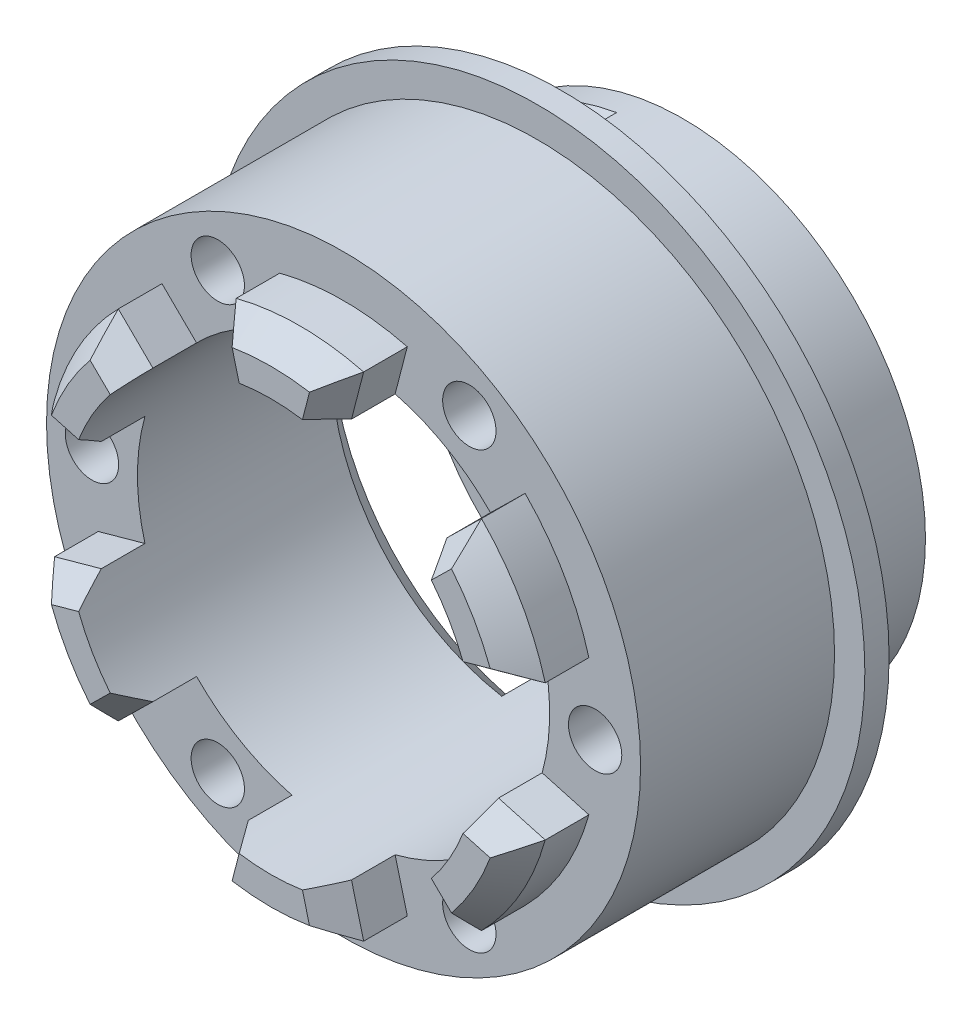
from build123d import *
from OCP.BRepFilletAPI import BRepFilletAPI_MakeChamfer

# Parameters (mm, degrees)
SKETCH_1_R          = 10
EXTRUDE_1_DEPTH     = 2
SKETCH_2_R          = 10
SKETCH_2_R_2        = 8.5
EXTRUDE_2_DEPTH     = 3
SKETCH_4_R          = 13.5
SKETCH_4_R_2        = 8.5
EXTRUDE_3_DEPTH     = 1
SKETCH_5_R          = 12.25
SKETCH_5_R_2        = 8.5
EXTRUDE_4_DEPTH     = 8
SKETCH_6_R          = 1.1
CUT_EXTRUDE_1_DEPTH = 8
SKETCH_7_R          = 3
SKETCH_7_R_2        = 1.15
CUT_EXTRUDE_2_DEPTH = 24.674881204
EXTRUDE_5_DEPTH     = 3
CHAMFER_1_SIZE      = 1.2
CHAMFER_1_SIZE2     = 0.840249046
CUT_EXTRUDE_START   = -2
SKETCH_11_R         = 1.15
CUT_EXTRUDE_3_DEPTH = 3
CHAMFER_2_SIZE      = 1


with BuildPart() as part:
    # 스케치1 → 보스-돌출1 (new body)
    with BuildSketch(Plane.XY):
        Circle(SKETCH_1_R)
    extrude(amount=EXTRUDE_1_DEPTH)

    # 스케치2 → 보스-돌출2 (add)
    with BuildSketch(Plane.XY.offset(2)):
        Circle(SKETCH_2_R)
        Circle(SKETCH_2_R_2, mode=Mode.SUBTRACT)
    extrude(amount=EXTRUDE_2_DEPTH)

    # 스케치4 → 보스-돌출3 (add)
    with BuildSketch(Plane.XY.offset(5)):
        Circle(SKETCH_4_R)
        Circle(SKETCH_4_R_2, mode=Mode.SUBTRACT)
    extrude(amount=EXTRUDE_3_DEPTH)

    # 스케치5 → 보스-돌출4 (add)
    with BuildSketch(Plane.XY.offset(6)):
        Circle(SKETCH_5_R)
        Circle(SKETCH_5_R_2, mode=Mode.SUBTRACT)
    extrude(amount=EXTRUDE_4_DEPTH)

    # 스케치6 → 컷-돌출1 (cut)
    with BuildSketch(Plane.XY.offset(14)):
        with Locations((10.375, 0)):
            Circle(SKETCH_6_R)
        with Locations((5.1875, -8.985013564)):
            Circle(SKETCH_6_R)
        with Locations((-5.1875, -8.985013564)):
            Circle(SKETCH_6_R)
        with Locations((-10.375, 0)):
            Circle(SKETCH_6_R)
        with Locations((-5.1875, 8.985013564)):
            Circle(SKETCH_6_R)
        with Locations((5.1875, 8.985013564)):
            Circle(SKETCH_6_R)
    extrude(amount=-CUT_EXTRUDE_1_DEPTH, mode=Mode.SUBTRACT)

    # 스케치7 → 컷-돌출2 (cut, through all)
    with BuildSketch(Plane(origin=(0, 0, 0), x_dir=(-1, 0, 0), z_dir=(0, 0, -1))):
        Circle(SKETCH_7_R)
        with Locations((-7, 0)):
            Circle(SKETCH_7_R_2)
        with Locations((7, 0)):
            Circle(SKETCH_7_R_2)
        with Locations((0, 7)):
            Circle(SKETCH_7_R_2)
        with Locations((0, -7)):
            Circle(SKETCH_7_R_2)
    extrude(amount=-CUT_EXTRUDE_2_DEPTH, mode=Mode.SUBTRACT)

    # 스케치10 → 보스-돌출5 (add)
    with BuildSketch(Plane.XY.offset(14)):
        with BuildLine():
            Line((-2.128230034, 8.229254943), (-2.628990043, 10.165550224))
            ThreePointArc((-2.628990043, 10.165550224), (0, 10.5), (2.628990043, 10.165550224))
            Line((2.628990043, 10.165550224), (2.128230034, 8.229254943))
            ThreePointArc((2.128230034, 8.229254943), (0, 8.5), (-2.128230034, 8.229254943))
        make_face()
        with BuildLine():
            Line((6.062628818, 5.957728747), (7.489129716, 7.359547275))
            ThreePointArc((7.489129716, 7.359547275), (9.09326674, 5.25), (10.118119759, 2.806002949))
            Line((10.118119759, 2.806002949), (8.190858852, 2.271526197))
            ThreePointArc((8.190858852, 2.271526197), (7.361215932, 4.25), (6.062628818, 5.957728747))
        make_face()
        with BuildLine():
            Line((-8.190858852, 2.271526197), (-10.118119759, 2.806002949))
            ThreePointArc((-10.118119759, 2.806002949), (-9.09326674, 5.25), (-7.489129716, 7.359547275))
            Line((-7.489129716, 7.359547275), (-6.062628818, 5.957728747))
            ThreePointArc((-6.062628818, 5.957728747), (-7.361215932, 4.25), (-8.190858852, 2.271526197))
        make_face()
        with BuildLine():
            Line((8.190858852, -2.271526197), (10.118119759, -2.806002949))
            ThreePointArc((10.118119759, -2.806002949), (9.09326674, -5.25), (7.489129716, -7.359547275))
            Line((7.489129716, -7.359547275), (6.062628818, -5.957728747))
            ThreePointArc((6.062628818, -5.957728747), (7.361215932, -4.25), (8.190858852, -2.271526197))
        make_face()
        with BuildLine():
            Line((2.128230034, -8.229254943), (2.628990043, -10.165550224))
            ThreePointArc((2.628990043, -10.165550224), (0, -10.5), (-2.628990043, -10.165550224))
            Line((-2.628990043, -10.165550224), (-2.128230034, -8.229254943))
            ThreePointArc((-2.128230034, -8.229254943), (0, -8.5), (2.128230034, -8.229254943))
        make_face()
        with BuildLine():
            Line((-6.062628818, -5.957728747), (-7.489129716, -7.359547275))
            ThreePointArc((-7.489129716, -7.359547275), (-9.09326674, -5.25), (-10.118119759, -2.806002949))
            Line((-10.118119759, -2.806002949), (-8.190858852, -2.271526197))
            ThreePointArc((-8.190858852, -2.271526197), (-7.361215932, -4.25), (-6.062628818, -5.957728747))
        make_face()
    extrude(amount=EXTRUDE_5_DEPTH)

    # 모따기1: one chamfer whose edges measure the first distance from different faces: ONE call of the kernel's chamfer builder (chamfer() names one face for all edges)
    chamfer_1_edges_1 = [part.edges().sort_by_distance(p)[0] for p in [
        (-9.09326674, -5.25, 17),
    ]]
    chamfer_1_side_1 = [part.faces().sort_by_distance(p)[0] for p in [
        (-9.09326674, -5.25, 15.5),
    ]]
    chamfer_1_edges_2 = [part.edges().sort_by_distance(p)[0] for p in [
        (0, -10.5, 17),
    ]]
    chamfer_1_side_2 = [part.faces().sort_by_distance(p)[0] for p in [
        (0, -10.5, 15.5),
    ]]
    chamfer_1_edges_3 = [part.edges().sort_by_distance(p)[0] for p in [
        (9.09326674, -5.25, 17),
    ]]
    chamfer_1_side_3 = [part.faces().sort_by_distance(p)[0] for p in [
        (9.09326674, -5.25, 15.5),
    ]]
    chamfer_1_edges_4 = [part.edges().sort_by_distance(p)[0] for p in [
        (9.09326674, 5.25, 17),
    ]]
    chamfer_1_side_4 = [part.faces().sort_by_distance(p)[0] for p in [
        (9.09326674, 5.25, 15.5),
    ]]
    chamfer_1_edges_5 = [part.edges().sort_by_distance(p)[0] for p in [
        (0, 10.5, 17),
    ]]
    chamfer_1_side_5 = [part.faces().sort_by_distance(p)[0] for p in [
        (0, 10.5, 15.5),
    ]]
    chamfer_1_edges_6 = [part.edges().sort_by_distance(p)[0] for p in [
        (-9.09326674, 5.25, 17),
    ]]
    chamfer_1_side_6 = [part.faces().sort_by_distance(p)[0] for p in [
        (-9.09326674, 5.25, 15.5),
    ]]
    chamfer_1_edges_7 = [part.edges().sort_by_distance(p)[0] for p in [
        (-9.154489305, -2.538764573, 17),
    ]]
    chamfer_1_side_7 = [part.faces().sort_by_distance(p)[0] for p in [
        (-9.154489305, -2.538764573, 15.5),
    ]]
    chamfer_1_edges_8 = [part.edges().sort_by_distance(p)[0] for p in [
        (-6.775879267, -6.658638011, 17),
    ]]
    chamfer_1_side_8 = [part.faces().sort_by_distance(p)[0] for p in [
        (-6.775879267, -6.658638011, 15.5),
    ]]
    chamfer_1_edges_9 = [part.edges().sort_by_distance(p)[0] for p in [
        (2.378610039, -9.197402584, 17),
    ]]
    chamfer_1_side_9 = [part.faces().sort_by_distance(p)[0] for p in [
        (2.378610039, -9.197402584, 15.5),
    ]]
    chamfer_1_edges_10 = [part.edges().sort_by_distance(p)[0] for p in [
        (-2.378610039, -9.197402584, 17),
    ]]
    chamfer_1_side_10 = [part.faces().sort_by_distance(p)[0] for p in [
        (-2.378610039, -9.197402584, 15.5),
    ]]
    chamfer_1_edges_11 = [part.edges().sort_by_distance(p)[0] for p in [
        (6.775879267, -6.658638011, 17),
    ]]
    chamfer_1_side_11 = [part.faces().sort_by_distance(p)[0] for p in [
        (6.775879267, -6.658638011, 15.5),
    ]]
    chamfer_1_edges_12 = [part.edges().sort_by_distance(p)[0] for p in [
        (9.154489305, -2.538764573, 17),
    ]]
    chamfer_1_side_12 = [part.faces().sort_by_distance(p)[0] for p in [
        (9.154489305, -2.538764573, 15.5),
    ]]
    chamfer_1_edges_13 = [part.edges().sort_by_distance(p)[0] for p in [
        (9.154489305, 2.538764573, 17),
    ]]
    chamfer_1_side_13 = [part.faces().sort_by_distance(p)[0] for p in [
        (9.154489305, 2.538764573, 15.5),
    ]]
    chamfer_1_edges_14 = [part.edges().sort_by_distance(p)[0] for p in [
        (6.775879267, 6.658638011, 17),
    ]]
    chamfer_1_side_14 = [part.faces().sort_by_distance(p)[0] for p in [
        (6.775879267, 6.658638011, 15.5),
    ]]
    chamfer_1_edges_15 = [part.edges().sort_by_distance(p)[0] for p in [
        (2.378610039, 9.197402584, 17),
    ]]
    chamfer_1_side_15 = [part.faces().sort_by_distance(p)[0] for p in [
        (2.378610039, 9.197402584, 15.5),
    ]]
    chamfer_1_edges_16 = [part.edges().sort_by_distance(p)[0] for p in [
        (-2.378610039, 9.197402584, 17),
    ]]
    chamfer_1_side_16 = [part.faces().sort_by_distance(p)[0] for p in [
        (-2.378610039, 9.197402584, 15.5),
    ]]
    chamfer_1_edges_17 = [part.edges().sort_by_distance(p)[0] for p in [
        (-9.154489305, 2.538764573, 17),
    ]]
    chamfer_1_side_17 = [part.faces().sort_by_distance(p)[0] for p in [
        (-9.154489305, 2.538764573, 15.5),
    ]]
    chamfer_1_edges_18 = [part.edges().sort_by_distance(p)[0] for p in [
        (-6.775879267, 6.658638011, 17),
    ]]
    chamfer_1_side_18 = [part.faces().sort_by_distance(p)[0] for p in [
        (-6.775879267, 6.658638011, 15.5),
    ]]
    chamfer_1 = BRepFilletAPI_MakeChamfer(part.part.solid().wrapped)
    for e in chamfer_1_edges_1:
        chamfer_1.Add(CHAMFER_1_SIZE, CHAMFER_1_SIZE2, e.wrapped, chamfer_1_side_1[0].wrapped)  # the first distance lies on this face
    for e in chamfer_1_edges_2:
        chamfer_1.Add(CHAMFER_1_SIZE, CHAMFER_1_SIZE2, e.wrapped, chamfer_1_side_2[0].wrapped)  # the first distance lies on this face
    for e in chamfer_1_edges_3:
        chamfer_1.Add(CHAMFER_1_SIZE, CHAMFER_1_SIZE2, e.wrapped, chamfer_1_side_3[0].wrapped)  # the first distance lies on this face
    for e in chamfer_1_edges_4:
        chamfer_1.Add(CHAMFER_1_SIZE, CHAMFER_1_SIZE2, e.wrapped, chamfer_1_side_4[0].wrapped)  # the first distance lies on this face
    for e in chamfer_1_edges_5:
        chamfer_1.Add(CHAMFER_1_SIZE, CHAMFER_1_SIZE2, e.wrapped, chamfer_1_side_5[0].wrapped)  # the first distance lies on this face
    for e in chamfer_1_edges_6:
        chamfer_1.Add(CHAMFER_1_SIZE, CHAMFER_1_SIZE2, e.wrapped, chamfer_1_side_6[0].wrapped)  # the first distance lies on this face
    for e in chamfer_1_edges_7:
        chamfer_1.Add(CHAMFER_1_SIZE, CHAMFER_1_SIZE2, e.wrapped, chamfer_1_side_7[0].wrapped)  # the first distance lies on this face
    for e in chamfer_1_edges_8:
        chamfer_1.Add(CHAMFER_1_SIZE, CHAMFER_1_SIZE2, e.wrapped, chamfer_1_side_8[0].wrapped)  # the first distance lies on this face
    for e in chamfer_1_edges_9:
        chamfer_1.Add(CHAMFER_1_SIZE, CHAMFER_1_SIZE2, e.wrapped, chamfer_1_side_9[0].wrapped)  # the first distance lies on this face
    for e in chamfer_1_edges_10:
        chamfer_1.Add(CHAMFER_1_SIZE, CHAMFER_1_SIZE2, e.wrapped, chamfer_1_side_10[0].wrapped)  # the first distance lies on this face
    for e in chamfer_1_edges_11:
        chamfer_1.Add(CHAMFER_1_SIZE, CHAMFER_1_SIZE2, e.wrapped, chamfer_1_side_11[0].wrapped)  # the first distance lies on this face
    for e in chamfer_1_edges_12:
        chamfer_1.Add(CHAMFER_1_SIZE, CHAMFER_1_SIZE2, e.wrapped, chamfer_1_side_12[0].wrapped)  # the first distance lies on this face
    for e in chamfer_1_edges_13:
        chamfer_1.Add(CHAMFER_1_SIZE, CHAMFER_1_SIZE2, e.wrapped, chamfer_1_side_13[0].wrapped)  # the first distance lies on this face
    for e in chamfer_1_edges_14:
        chamfer_1.Add(CHAMFER_1_SIZE, CHAMFER_1_SIZE2, e.wrapped, chamfer_1_side_14[0].wrapped)  # the first distance lies on this face
    for e in chamfer_1_edges_15:
        chamfer_1.Add(CHAMFER_1_SIZE, CHAMFER_1_SIZE2, e.wrapped, chamfer_1_side_15[0].wrapped)  # the first distance lies on this face
    for e in chamfer_1_edges_16:
        chamfer_1.Add(CHAMFER_1_SIZE, CHAMFER_1_SIZE2, e.wrapped, chamfer_1_side_16[0].wrapped)  # the first distance lies on this face
    for e in chamfer_1_edges_17:
        chamfer_1.Add(CHAMFER_1_SIZE, CHAMFER_1_SIZE2, e.wrapped, chamfer_1_side_17[0].wrapped)  # the first distance lies on this face
    for e in chamfer_1_edges_18:
        chamfer_1.Add(CHAMFER_1_SIZE, CHAMFER_1_SIZE2, e.wrapped, chamfer_1_side_18[0].wrapped)  # the first distance lies on this face
    add(Compound.cast(chamfer_1.Shape()), mode=Mode.REPLACE)

    # 스케치11 → 컷-돌출3 (cut)
    with BuildSketch(Plane(origin=(0, 0, 0), x_dir=(-1, 0, 0), z_dir=(0, 0, -1)).offset(CUT_EXTRUDE_START)):
        with BuildLine():
            Line((1.736481777, 9.84807753), (0.520944533, 2.954423259))
            ThreePointArc((0.520944533, 2.954423259), (3, 0), (0.520944533, -2.954423259))
            Line((0.520944533, -2.954423259), (1.736481777, -9.84807753))
            ThreePointArc((1.736481777, -9.84807753), (10, 0), (1.736481777, 9.84807753))
        make_face()
        with Locations((7, 0)):
            Circle(SKETCH_11_R, mode=Mode.SUBTRACT)
    extrude(amount=-CUT_EXTRUDE_3_DEPTH, mode=Mode.SUBTRACT)

    # 모따기2
    chamfer_2_edges = [part.edges().sort_by_distance(p)[0] for p in [
        (-8.5, 0, 5),
        (-10, 0, 2),
    ]]
    chamfer(chamfer_2_edges, length=CHAMFER_2_SIZE)


solid = part.part
